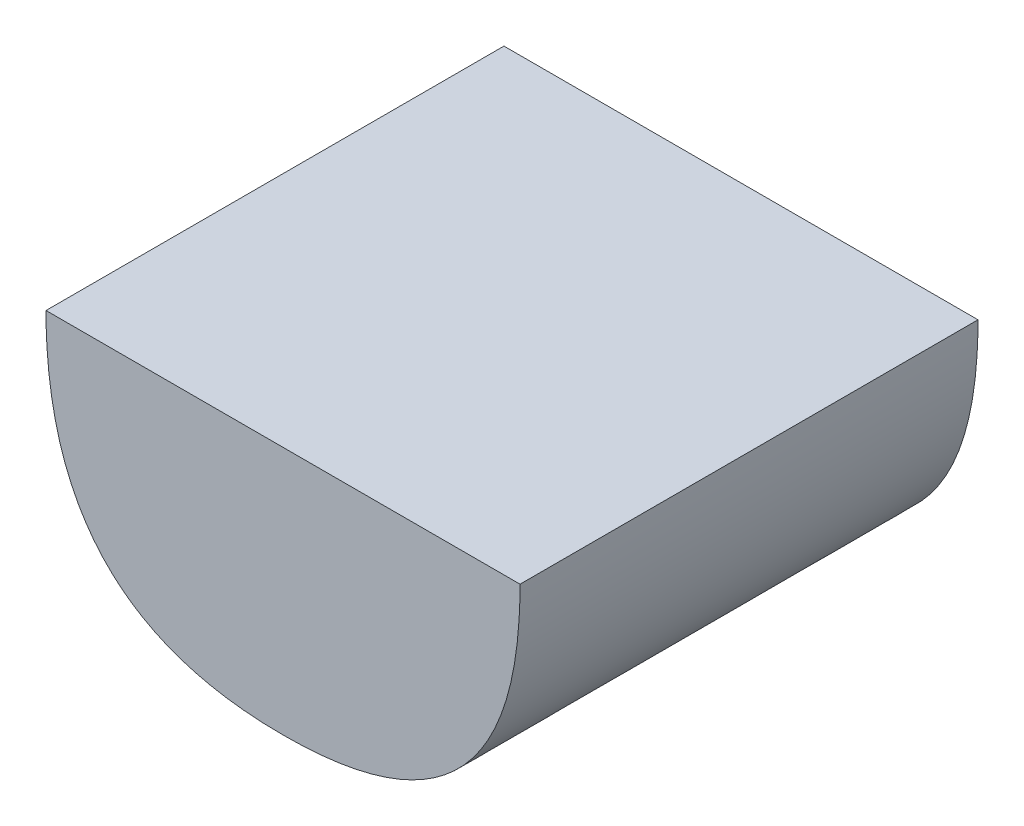
from build123d import *

# Parameters (mm, degrees)
BOSS_EXTRUDE1_DEPTH = 584.2


with BuildPart() as part:
    # Sketch1 → Boss-Extrude1 (new body)
    with BuildSketch(Plane.XY):
        with BuildLine():
            Line((-302.357037841, 317.813001305), (302.357037841, 317.813001305))
            add(Edge.make_bspline(
                [(0, 0), (302.357037841, -0.066445002), (302.357037841, 317.813001305)],
                knots=[0, 0, 0, 1, 1, 1], degree=2, weights=[1, 1.019369595, 1]))
            add(Edge.make_bspline(
                [(0, 0), (-302.357037841, -0.066445002), (-302.357037841, 317.813001305)],
                knots=[0, 0, 0, 1, 1, 1], degree=2, weights=[1, 1.019369595, 1]))
        make_face()
    extrude(amount=-BOSS_EXTRUDE1_DEPTH)


solid = part.part
